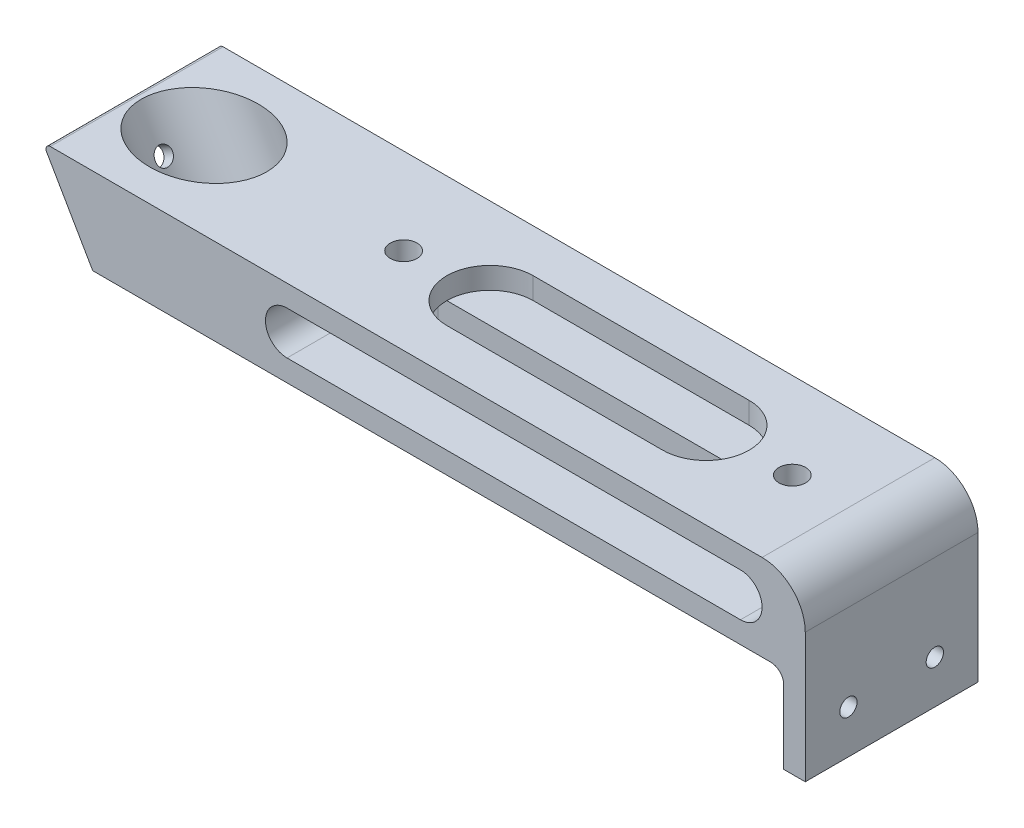
from build123d import *

# Parameters (mm, degrees)
EXTRUDE_1_DEPTH     = 40
SKETCH_2_R          = 12.6
CUT_EXTRUDE_1_DEPTH = 183.123159181
CUT_EXTRUDE_2_REACH = 172.953
SKETCH_3_R          = 2
SKETCH_4_W          = 5
SKETCH_4_H          = 40
EXTRUDE_2_DEPTH     = 20
SKETCH_5_R          = 2
CUT_EXTRUDE_3_DEPTH = 178.280498251
FILLET_1_R          = 10
FILLET_2_R          = 3
CUT_EXTRUDE_4_DEPTH = 171.953209984
SKETCH_7_R          = 3.1
CUT_EXTRUDE_5_DEPTH = 171.953209984
CUT_EXTRUDE_6_REACH = 172.953
FILLET_3_R          = 1
CUT_EXTRUDE_7_REACH = 175.349


with BuildPart() as part:
    # 草图1 → 凸台-拉伸1 (new body)
    with BuildSketch(Plane.XY):
        Polygon((0, 0), (165, 0), (165, 20), (-11.547005384, 20), align=None)
    extrude(amount=EXTRUDE_1_DEPTH)

    # 草图2 → 切除-拉伸1 (cut, through all)
    with BuildSketch(Plane(origin=(-11.547005384, 20, 0), x_dir=(0, 0, -1), z_dir=(-0.4999999999999949, 0.8660254037844416, 0))):
        with Locations((-20, -15)):
            Circle(SKETCH_2_R)
    extrude(amount=-CUT_EXTRUDE_1_DEPTH, mode=Mode.SUBTRACT)

    # 草图3 → 切除-拉伸2 (cut, up to next)
    with BuildSketch(Plane(origin=(0, 0, 0), x_dir=(0, 0, 1), z_dir=(-0.8660254037844417, -0.4999999999999949, 0)), mode=Mode.PRIVATE) as cut_extrude_2_sk1:
        with Locations((20, 11.46723296)):
            Circle(SKETCH_3_R)
    cut_extrude_2_tool1 = extrude(cut_extrude_2_sk1.sketch, amount=-CUT_EXTRUDE_2_REACH, mode=Mode.PRIVATE) & part.part
    add(cut_extrude_2_tool1.solids().sort_by_distance((-5.733616, 9.930915, 20))[0], mode=Mode.SUBTRACT)

    # 草图4 → 凸台-拉伸2 (add)
    with BuildSketch(Plane.XZ):
        with Locations((162.5, 20)):
            Rectangle(SKETCH_4_W, SKETCH_4_H)
    extrude(amount=EXTRUDE_2_DEPTH)

    # 草图5 → 切除-拉伸3 (cut, through all)
    with BuildSketch(Plane.ZY.offset(-160)):
        with Locations((10, -10)):
            Circle(SKETCH_5_R)
        with Locations((30, -10)):
            Circle(SKETCH_5_R)
    extrude(amount=-CUT_EXTRUDE_3_DEPTH, mode=Mode.SUBTRACT)

    # 圆角1
    fillet_1_edges = [part.edges().sort_by_distance(p)[0] for p in [
        (165, 20, 20),
    ]]
    fillet(fillet_1_edges, radius=FILLET_1_R)

    # 圆角2
    fillet_2_edges = [part.edges().sort_by_distance(p)[0] for p in [
        (160, 0, 20),
    ]]
    fillet(fillet_2_edges, radius=FILLET_2_R)

    # 草图6 → 切除-拉伸4 (cut, through all)
    with BuildSketch(Plane(origin=(0, 0, 0), x_dir=(-1, 0, 0), z_dir=(0, 0, -1))):
        with BuildLine():
            Line((-150, 15), (-45, 15))
            ThreePointArc((-45, 15), (-40, 10), (-45, 5))
            Line((-45, 5), (-150, 5))
            ThreePointArc((-150, 5), (-155, 10), (-150, 15))
        make_face()
    extrude(amount=-CUT_EXTRUDE_4_DEPTH, mode=Mode.SUBTRACT)

    # 草图7 → 切除-拉伸5 (cut, through all)
    with BuildSketch(Plane.XZ):
        with Locations((52, 20)):
            Circle(SKETCH_7_R)
        with Locations((142, 20)):
            Circle(SKETCH_7_R)
    extrude(amount=-CUT_EXTRUDE_5_DEPTH, mode=Mode.SUBTRACT)

    # 草图8 → 切除-拉伸6 (cut, up to next)
    with BuildSketch(Plane.XZ, mode=Mode.PRIVATE) as cut_extrude_6_sk1:
        with BuildLine():
            Line((50, 30), (144, 30))
            ThreePointArc((144, 30), (146.121320344, 29.121320344), (147, 27))
            Line((147, 27), (147, 13))
            ThreePointArc((147, 13), (146.121320344, 10.878679656), (144, 10))
            Line((144, 10), (50, 10))
            ThreePointArc((50, 10), (47.878679656, 10.878679656), (47, 13))
            Line((47, 13), (47, 27))
            ThreePointArc((47, 27), (47.878679656, 29.121320344), (50, 30))
        make_face()
    cut_extrude_6_tool1 = extrude(cut_extrude_6_sk1.sketch, amount=-CUT_EXTRUDE_6_REACH, mode=Mode.PRIVATE) & part.part
    add(cut_extrude_6_tool1.solids().sort_by_distance((97, 0, 20))[0], mode=Mode.SUBTRACT)

    # 圆角3
    fillet_3_edges = [part.edges().sort_by_distance(p)[0] for p in [
        (-11.547005384, 20, 20),
    ]]
    fillet(fillet_3_edges, radius=FILLET_3_R)

    # 草图9 → 切除-拉伸7 (cut, up to next)
    with BuildSketch(Plane.XZ.offset(-15), mode=Mode.PRIVATE) as cut_extrude_7_sk1:
        with BuildLine():
            Line((122, 10), (72, 10))
            ThreePointArc((72, 10), (62, 20), (72, 30))
            Line((72, 30), (122, 30))
            ThreePointArc((122, 30), (132, 20), (122, 10))
        make_face()
    cut_extrude_7_tool1 = extrude(cut_extrude_7_sk1.sketch, amount=-CUT_EXTRUDE_7_REACH, mode=Mode.PRIVATE) & part.part
    add(cut_extrude_7_tool1.solids().sort_by_distance((97, 15, 20))[0], mode=Mode.SUBTRACT)


solid = part.part
